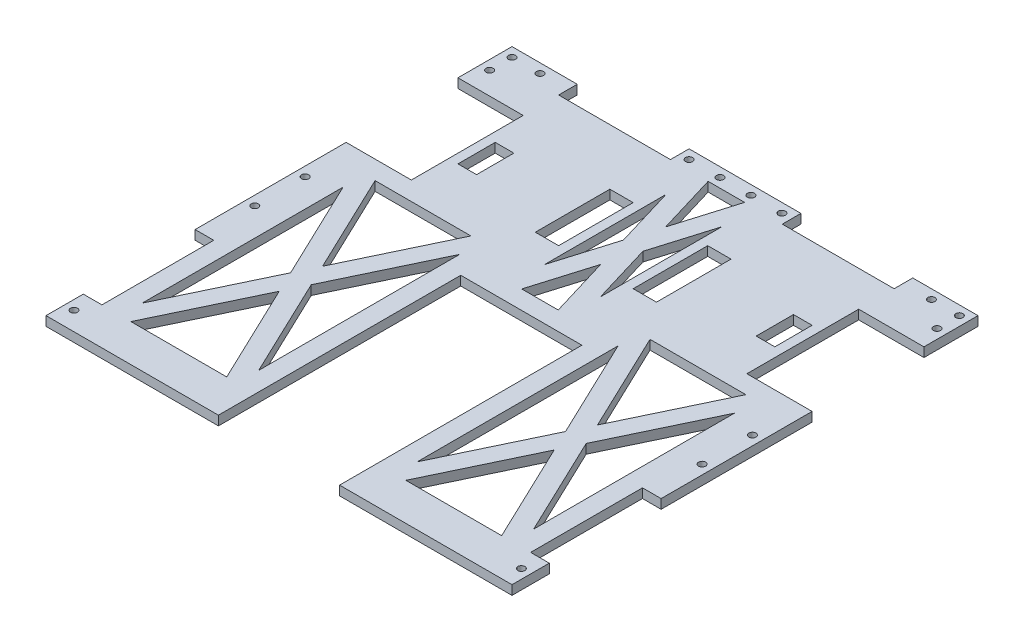
from build123d import *

# Parameters (mm, degrees)
BOSS_EXTRUDE1_DEPTH = 6.35
SKETCH2_W           = 44.45
SKETCH2_H           = 76.2
SKETCH2_W_2         = 12.7
SKETCH2_W_3         = 76.2
SKETCH2_H_2         = 12.7
CUT_EXTRUDE1_DEPTH  = 289.907554418
CUT_EXTRUDE3_DEPTH  = 289.907554418
SKETCH3_W           = 15.875
SKETCH3_H           = 50.8
SKETCH3_W_2         = 12.7
SKETCH3_H_2         = 25.4
CUT_EXTRUDE2_DEPTH  = 289.907554418
CUT_EXTRUDE5_DEPTH  = 289.907554418
SKETCH7_R           = 2.413
CUT_EXTRUDE6_DEPTH  = 289.907554418


with BuildPart() as part:
    # Sketch1 → Boss-Extrude1 (new body)
    with BuildSketch(Plane(origin=(0, 0, 0), x_dir=(1, 0, 0), z_dir=(0, 1, 0))):
        Polygon((-158.75, 76.2), (-158.75, -241.3), (-41.275, -241.3), (-41.275, -76.2), (41.275, -76.2), (41.275, -241.3), (158.75, -241.3), (158.75, 76.2), align=None)
    extrude(amount=BOSS_EXTRUDE1_DEPTH)

    # Sketch2 → Cut-Extrude1 (cut, through all)
    with BuildSketch(Plane(origin=(0, 6.35, 0), x_dir=(1, 0, 0), z_dir=(0, 1, 0))):
        with Locations((136.525, 1.27)):
            Rectangle(SKETCH2_W, SKETCH2_H)
        with Locations((152.4, -177.8)):
            Rectangle(SKETCH2_W_2, SKETCH2_H)
        with Locations((-152.4, -177.8)):
            Rectangle(SKETCH2_W_2, SKETCH2_H)
        with Locations((-136.525, 1.27)):
            Rectangle(SKETCH2_W, SKETCH2_H)
        with Locations((-76.2, 69.85)):
            Rectangle(SKETCH2_W_3, SKETCH2_H_2)
        with Locations((76.2, 69.85)):
            Rectangle(SKETCH2_W_3, SKETCH2_H_2)
    extrude(amount=-CUT_EXTRUDE1_DEPTH, mode=Mode.SUBTRACT)

    # Sketch4 → Cut-Extrude3 (cut, through all)
    with BuildSketch(Plane(origin=(0, 6.35, 0), x_dir=(1, 0, 0), z_dir=(0, 1, 0))):
        Polygon((93.6625, -147.46179464), (61.010684466, -215.9), (126.314315534, -215.9), align=None)
        Polygon((53.975, -64.27679464), (53.975, -201.15320536), (86.626815534, -132.715), align=None)
        Polygon((133.35, -64.27679464), (100.698184466, -132.715), (133.35, -201.15320536), align=None)
        Polygon((61.010684466, -49.53), (93.6625, -117.96820536), (126.314315534, -49.53), align=None)
        Polygon((-86.626815534, -132.715), (-53.975, -201.15320536), (-53.975, -64.27679464), align=None)
        Polygon((-126.314315534, -49.53), (-93.6625, -117.96820536), (-61.010684466, -49.53), align=None)
        Polygon((-61.010684466, -215.9), (-93.6625, -147.46179464), (-126.314315534, -215.9), align=None)
        Polygon((-133.35, -201.15320536), (-100.698184466, -132.715), (-133.35, -64.27679464), align=None)
    extrude(amount=-CUT_EXTRUDE3_DEPTH, mode=Mode.SUBTRACT)

    # Sketch3 → Cut-Extrude2 (cut, through all)
    with BuildSketch(Plane(origin=(0, 6.35, 0), x_dir=(1, 0, 0), z_dir=(0, 1, 0))):
        with Locations((-33.3375, 0)):
            Rectangle(SKETCH3_W, SKETCH3_H)
        with Locations((33.3375, 0)):
            Rectangle(SKETCH3_W, SKETCH3_H)
        with Locations((101.6, 1.27)):
            Rectangle(SKETCH3_W_2, SKETCH3_H_2)
        with Locations((-101.6, 1.27)):
            Rectangle(SKETCH3_W_2, SKETCH3_H_2)
    extrude(amount=-CUT_EXTRUDE2_DEPTH, mode=Mode.SUBTRACT)

    # Sketch6 → Cut-Extrude5 (cut, through all)
    with BuildSketch(Plane(origin=(0, 6.35, 0), x_dir=(1, 0, 0), z_dir=(0, 1, 0))):
        Polygon((12.420405367, 63.5), (-12.420405367, 63.5), (0, 22.098648777), align=None)
        Polygon((-6.629594633, 0), (-19.05, 41.401351223), (-19.05, -41.401351223), align=None)
        Polygon((19.05, 41.401351223), (6.629594633, 0), (19.05, -41.401351223), align=None)
        Polygon((12.420405367, -63.5), (0, -22.098648777), (-12.420405367, -63.5), align=None)
    extrude(amount=-CUT_EXTRUDE5_DEPTH, mode=Mode.SUBTRACT)

    # Sketch7 → Cut-Extrude6 (cut, through all)
    with BuildSketch(Plane(origin=(0, 6.35, 0), x_dir=(1, 0, 0), z_dir=(0, 1, 0))):
        with Locations((152.4, -105.41)):
            Circle(SKETCH7_R)
        with Locations((152.4, -71.12)):
            Circle(SKETCH7_R)
        with Locations((152.4, -228.6)):
            Circle(SKETCH7_R)
        with Locations((152.4, 69.85)):
            Circle(SKETCH7_R)
        with Locations((133.35, 69.85)):
            Circle(SKETCH7_R)
        with Locations((152.4, 54.61)):
            Circle(SKETCH7_R)
        with Locations((-152.4, -228.6)):
            Circle(SKETCH7_R)
        with Locations((-31.75, 69.85)):
            Circle(SKETCH7_R)
        with Locations((-10.668, 69.85)):
            Circle(SKETCH7_R)
        with Locations((10.414, 69.85)):
            Circle(SKETCH7_R)
        with Locations((31.496, 69.85)):
            Circle(SKETCH7_R)
        with Locations((-152.4, 54.61)):
            Circle(SKETCH7_R)
        with Locations((-133.35, 69.85)):
            Circle(SKETCH7_R)
        with Locations((-152.4, 69.85)):
            Circle(SKETCH7_R)
        with Locations((-152.4, -71.12)):
            Circle(SKETCH7_R)
        with Locations((-152.4, -105.41)):
            Circle(SKETCH7_R)
    extrude(amount=-CUT_EXTRUDE6_DEPTH, mode=Mode.SUBTRACT)


solid = part.part
